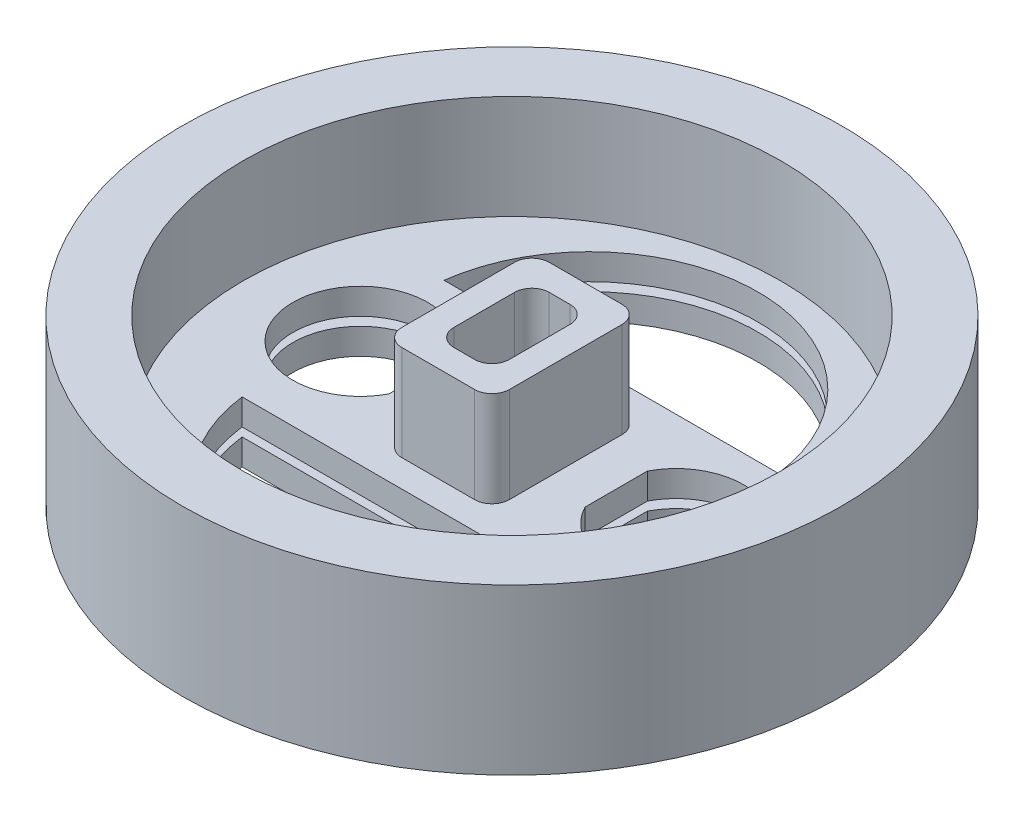
from build123d import *

# Parameters (mm, degrees)
SKETCH4_R           = 17
BOSS_EXTRUDE3_DEPTH = 6
SHELL4_T            = 0.5
SKETCH5_W           = 3.2
SKETCH5_H           = 5.5
BOSS_EXTRUDE4_DEPTH = 7
SHELL5_T            = 1.5
CUT_EXTRUDE2_DEPTH  = 69.741433184
FILLET1_R           = 1


with BuildPart() as part:
    # Sketch4 → Boss-Extrude3 (new body)
    with BuildSketch(Plane(origin=(0, 0, 0), x_dir=(1, 0, 0), z_dir=(0, 1, 0))):
        with Locations((0, -46.79046007)):
            Circle(SKETCH4_R)
    extrude(amount=BOSS_EXTRUDE3_DEPTH)

    # Shell4
    shell4_openings = [part.faces().sort_by_distance(p)[0] for p in [
        (0, 6, 46.79046007),
    ]]
    offset(amount=SHELL4_T, openings=shell4_openings, kind=Kind.INTERSECTION)

    # Sketch5 → Boss-Extrude4 (add)
    with BuildSketch(Plane(origin=(0, 0, 0), x_dir=(1, 0, 0), z_dir=(0, 1, 0))):
        with Locations((0, -46.79046007)):
            Rectangle(SKETCH5_W, SKETCH5_H)
    extrude(amount=BOSS_EXTRUDE4_DEPTH)

    # Shell5
    shell5_openings = [part.faces().sort_by_distance(p)[0] for p in [
        (0, 7, 46.79046007),
    ]]
    offset(amount=SHELL5_T, openings=shell5_openings, kind=Kind.INTERSECTION)

    # Sketch8 → Cut-Extrude2 (cut, through all)
    with BuildSketch(Plane(origin=(0, 1.5, 0), x_dir=(1, 0, 0), z_dir=(0, 1, 0))):
        with BuildLine():
            Line((-9.736425903, -40.96944233), (9.535773011, -40.96944233))
            ThreePointArc((9.535773011, -40.96944233), (-0.100326446, -32.500466178), (-9.736425903, -40.96944233))
        make_face()
        with BuildLine():
            Line((-9.736425903, -52.61147781), (9.535773011, -52.61147781))
            ThreePointArc((9.535773011, -52.61147781), (-0.100326446, -61.080453963), (-9.736425903, -52.61147781))
        make_face()
        with BuildLine():
            Line((-5.651322976, -44.628261801), (-5.651322976, -48.229929487))
            ThreePointArc((-5.651322976, -48.229929487), (-12.990843168, -46.429095644), (-5.651322976, -44.628261801))
        make_face()
        with BuildLine():
            Line((5.651322976, -44.628261801), (5.651322976, -48.229929487))
            ThreePointArc((5.651322976, -48.229929487), (12.990843168, -46.429095644), (5.651322976, -44.628261801))
        make_face()
    extrude(amount=-CUT_EXTRUDE2_DEPTH, mode=Mode.SUBTRACT)

    # Fillet1
    fillet1_edges = [part.edges().sort_by_distance(p)[0] for p in [
        (-1.6, 3.5, 49.54046007),
        (1.6, 3.5, 49.54046007),
        (-1.6, 3.5, 44.04046007),
        (1.6, 3.5, 44.04046007),
        (-3.1, 4.25, 42.54046007),
        (3.1, 4.25, 42.54046007),
        (3.1, 4.25, 51.04046007),
        (-3.1, 4.25, 51.04046007),
    ]]
    fillet(fillet1_edges, radius=FILLET1_R)


solid = part.part
